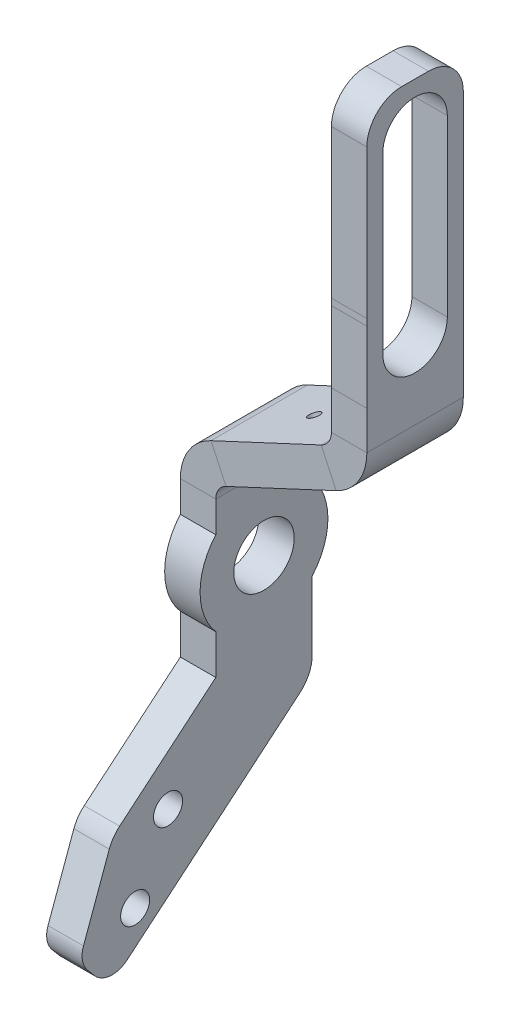
from build123d import *

# Parameters (mm, degrees)
BASE_FLANGE1_START      = -3.048
BASE_FLANGE1_OUTLINE_R  = 2.6
BASE_FLANGE1_DEPTH      = 3.048
CHAMFER1_SIZE           = 5.5
CHAMFER1_SIZE2          = 9.526279442
FILLET5_R               = 3
JOG1_START              = -31.942217141
JOG1_DEPTH              = 22.299805307
JOG1_START_2            = -30.592217141
JOG1_2_DEPTH            = 1.375
JOG1_START_3            = -23.667217141
JOG1_3_DEPTH            = 1.375
JOG1_START_4            = -30.595801154
JOG1_4_DEPTH            = 8.307168025
JOG1_5_DEPTH            = 13
EDGE_FLANGE1_DEPTH      = 15
FILLET4_R               = 3
CUT_EXTRUDE4_DEPTH      = 85.269968197
CUT_EXTRUDE4_DEPTH_BACK = 85.269968197
M3X0_5_TAPPED_HOLE2_D   = 2.5
CUT_EXTRUDE5_REACH      = 59.699
SKETCH19_R              = 0.5
CUT_EXTRUDE6_DEPTH      = 80.832983383
FILLET9_R               = 2


with BuildPart() as part:
    # Base-Flange1: read off the stored shape, not the designer's step
    # Base-Flange1 outline → Base-Flange1 (new body)
    with BuildSketch(Plane(origin=(0, 0, 0), x_dir=(0, 0, -1), z_dir=(1, 0, 0)).offset(BASE_FLANGE1_START)):
        with BuildLine():
            Line((11.442217141, 3.034903463), (29.520579971, 18.204451045))
            ThreePointArc((29.520579971, 18.204451045), (30.311140503, 19.234729589), (30.592217141, 20.502584374))
            Line((30.592217141, 20.502584374), (30.592217141, 26.390637175))
            ThreePointArc((30.592217141, 26.390637175), (31.942217141, 30), (30.592217141, 33.609362825))
            Line((30.592217141, 33.609362825), (30.592217141, 49.531723164))
            Line((30.592217141, 49.531723164), (30.595801154, 55.658476217))
            Line((30.595801154, 55.658476217), (30.592217141, 56.218276836))
            Line((30.592217141, 56.218276836), (30.592217141, 72))
            Line((30.592217141, 72), (22.292217141, 72))
            Line((22.292217141, 72), (22.292217141, 56.218276836))
            Line((22.292217141, 56.218276836), (22.288633129, 55.658476217))
            Line((22.288633129, 55.658476217), (22.292217141, 49.531723164))
            Line((22.292217141, 49.531723164), (22.292217141, 33.609362825))
            ThreePointArc((22.292217141, 33.609362825), (20.942217141, 30), (22.292217141, 26.390637175))
            Line((22.292217141, 26.390637175), (22.292217141, 22.974014962))
            Line((22.292217141, 22.974014962), (6.107079981, 9.393072341))
            Line((6.107079981, 9.393072341), (11.442217141, 3.034903463))
        make_face()
        with Locations((26.442217141, 30)):
            Circle(BASE_FLANGE1_OUTLINE_R, mode=Mode.SUBTRACT)
        with BuildLine():
            ThreePointArc((23.667217141, 67.875), (26.442217141, 70.65), (29.217217141, 67.875))
            Line((29.217217141, 67.875), (29.217217141, 52.875))
            ThreePointArc((29.217217141, 52.875), (26.442217141, 50.1), (23.667217141, 52.875))
            Line((23.667217141, 52.875), (23.667217141, 67.875))
        make_face(mode=Mode.SUBTRACT)
    extrude(amount=BASE_FLANGE1_DEPTH)

    # Chamfer1
    chamfer1_edges = [part.edges().sort_by_distance(p)[0] for p in [
        (-1.524, 9.393072341, -6.107079981),
    ]]
    chamfer1_side = [part.faces().sort_by_distance(p)[0] for p in [
        (-1.524, 6.213987902, -8.774648561),
    ]]
    chamfer(chamfer1_edges, length=CHAMFER1_SIZE, length2=CHAMFER1_SIZE2, reference=chamfer1_side[0])

    # Fillet5
    fillet5_edges = [part.edges().sort_by_distance(p)[0] for p in [
        (-1.524, 15.516446733, -13.404633411),
    ]]
    fillet(fillet5_edges, radius=FILLET5_R)

    # Jog1: read off the stored shape, not the designer's step
    # Jog1 outline → Jog1 (cut)
    with BuildSketch(Plane.XY.offset(JOG1_START)):
        with BuildLine():
            Line((-0.408210693, 40.414716045), (0, 40.605067817))
            Line((0, 40.605067817), (0, 72))
            Line((0, 72), (-3.048, 72))
            Line((-3.048, 72), (-3.048, 36.271076843))
            ThreePointArc((-3.048, 36.271076843), (-2.33198569, 38.727610652), (-0.408210693, 40.414716045))
        make_face()
    extrude(amount=JOG1_DEPTH, mode=Mode.SUBTRACT)

    # Jog1 2 outline → Jog1 2 (add)
    with BuildSketch(Plane.XY.offset(JOG1_START_2)):
        with BuildLine():
            ThreePointArc((0, 36.271076843), (0.238671437, 37.089921446), (0.879929769, 37.65228991))
            Line((0.879929769, 37.65228991), (10.360210693, 42.073017507))
            ThreePointArc((10.360210693, 42.073017507), (12.28398569, 43.7601229), (13, 46.216656709))
            Line((13, 46.216656709), (13, 72))
            Line((13, 72), (9.952, 72))
            Line((9.952, 72), (9.952, 46.216656709))
            ThreePointArc((9.952, 46.216656709), (9.713328563, 45.397812106), (9.072070231, 44.835443641))
            Line((9.072070231, 44.835443641), (0, 40.605067817))
            Line((0, 40.605067817), (0, 36.271076843))
        make_face()
    extrude(amount=JOG1_2_DEPTH)

    # Jog1 3 outline → Jog1 3 (add)
    with BuildSketch(Plane.XY.offset(JOG1_START_3)):
        with BuildLine():
            ThreePointArc((0, 36.271076843), (0.238671437, 37.089921446), (0.879929769, 37.65228991))
            Line((0.879929769, 37.65228991), (10.360210693, 42.073017507))
            ThreePointArc((10.360210693, 42.073017507), (12.28398569, 43.7601229), (13, 46.216656709))
            Line((13, 46.216656709), (13, 72))
            Line((13, 72), (9.952, 72))
            Line((9.952, 72), (9.952, 46.216656709))
            ThreePointArc((9.952, 46.216656709), (9.713328563, 45.397812106), (9.072070231, 44.835443641))
            Line((9.072070231, 44.835443641), (0, 40.605067817))
            Line((0, 40.605067817), (0, 36.271076843))
        make_face()
    extrude(amount=JOG1_3_DEPTH)

    # Jog1 4 outline → Jog1 4 (add)
    with BuildSketch(Plane.XY.offset(JOG1_START_4)):
        with BuildLine():
            ThreePointArc((0, 36.271076843), (0.238671437, 37.089921446), (0.879929769, 37.65228991))
            Line((0.879929769, 37.65228991), (10.360210693, 42.073017507))
            ThreePointArc((10.360210693, 42.073017507), (12.28398569, 43.7601229), (13, 46.216656709))
            Line((13, 46.216656709), (13, 72))
            Line((13, 72), (9.952, 72))
            Line((9.952, 72), (9.952, 46.216656709))
            ThreePointArc((9.952, 46.216656709), (9.713328563, 45.397812106), (9.072070231, 44.835443641))
            Line((9.072070231, 44.835443641), (0, 40.605067817))
            Line((0, 40.605067817), (0, 36.271076843))
        make_face()
    extrude(amount=JOG1_4_DEPTH)

    # Jog1 5 outline → Jog1 5 (cut)
    with BuildSketch(Plane.YZ):
        Polygon((49.531723164, -30.592217141), (35, -30.592217141), (35, -30.595801154), (55.658476217, -30.595801154), align=None)
        Polygon((35, -22.288633129), (35, -22.292217141), (49.531723164, -22.292217141), (55.658476217, -22.288633129), align=None)
        Polygon((56.218276836, -30.592217141), (55.658476217, -30.595801154), (73, -30.595801154), (73, -30.592217141), align=None)
        Polygon((73, -22.288633129), (55.658476217, -22.288633129), (56.218276836, -22.292217141), (73, -22.292217141), align=None)
        with BuildLine():
            Line((67.875, -23.667217141), (52.875, -23.667217141))
            ThreePointArc((52.875, -23.667217141), (50.1, -26.442217141), (52.875, -29.217217141))
            Line((52.875, -29.217217141), (67.875, -29.217217141))
            ThreePointArc((67.875, -29.217217141), (70.65, -26.442217141), (67.875, -23.667217141))
        make_face()
    extrude(amount=JOG1_5_DEPTH, mode=Mode.SUBTRACT)

    # Edge-Flange1: sheet metal written as solids
    # Edge-Flange1 section (on a plane across the edge) → Edge-Flange1 (add)
    with BuildSketch(Plane(origin=(0, 1.867451731, -12.421825459), x_dir=(3.4914813388431326e-15, 0.7660444431189821, 0.6427876096865346), z_dir=(0, 0.6427876096865346, -0.7660444431189821))):
        with BuildLine():
            Line((-3.048, 1.524), (-3.048, 29.952))
            Line((-3.048, 29.952), (0, 29.952))
            Line((0, 29.952), (0, 1.524))
            ThreePointArc((0, 1.524), (0.446369265, 0.446369265), (1.524, 0))
            Line((1.524, 0), (1.524, -3.048))
            ThreePointArc((1.524, -3.048), (-1.708892204, -1.708892204), (-3.048, 1.524))
        make_face()
    extrude(amount=EDGE_FLANGE1_DEPTH)

    # Fillet4
    fillet4_edges = [part.edges().sort_by_distance(p)[0] for p in [
        (11.476, 72, -30.592217141),
        (11.476, 72, -22.292217141),
    ]]
    fillet(fillet4_edges, radius=FILLET4_R)

    # Sketch17 → Cut-Extrude4 (cut, two sides: drawn at the far end of the back side and taken through both)
    with BuildSketch(Plane(origin=(0, 0, 0), x_dir=(0, 0, -1), z_dir=(1, 0, 0)).offset(-CUT_EXTRUDE4_DEPTH_BACK)):
        Polygon((22.932883788, 12.676717608), (2.605814743, -4.379718531), (8.769545562, -11.725366877), (29.096614607, 5.331069261), align=None)
    extrude(amount=CUT_EXTRUDE4_DEPTH + CUT_EXTRUDE4_DEPTH_BACK, mode=Mode.SUBTRACT)

    # M3x0.5 Tapped Hole2 (through all)
    with Locations(Plane(origin=(-3.048, 15.221364604, -18.186856854), x_dir=(0, 0, -1), z_dir=(-1, 0, 0))):
        with Locations((0, 0), (-2.828600732, 5.963347877)):
            Hole(M3X0_5_TAPPED_HOLE2_D / 2)

    # Sketch19 → Cut-Extrude5 (cut, up to next)
    with BuildSketch(Plane(origin=(-15.552643282, 33.35275115, 0), x_dir=(0.906307787036651, 0.4226182617406973, 0), z_dir=(-0.4226182617406973, 0.906307787036651, 0)), mode=Mode.PRIVATE) as cut_extrude5_sk1:
        with Locations(Location((21.940198833, 26.442217141, 0), (0, 0, 180))):
            Circle(SKETCH19_R)
    cut_extrude5_tool1 = extrude(cut_extrude5_sk1.sketch, amount=-CUT_EXTRUDE5_REACH, mode=Mode.PRIVATE) & part.part
    add(cut_extrude5_tool1.solids().sort_by_distance((4.33193, 42.62508, -26.442217))[0], mode=Mode.SUBTRACT)

    # Sketch21 → Cut-Extrude6 (cut, through all)
    with BuildSketch(Plane(origin=(0, 0, 0), x_dir=(0, 0, -1), z_dir=(1, 0, 0))):
        Polygon((10.514234213, 7.575140201), (9.642411834, 5.179827903), (11.442217141, 3.034903463), (13.133284575, 4.453877523), align=None)
    extrude(amount=-CUT_EXTRUDE6_DEPTH, mode=Mode.SUBTRACT)

    # Fillet9
    fillet9_edges = [part.edges().sort_by_distance(p)[0] for p in [
        (-1.524, 7.575140201, -10.514234213),
        (-1.524, 4.453877523, -13.133284575),
    ]]
    fillet(fillet9_edges, radius=FILLET9_R)


solid = part.part
